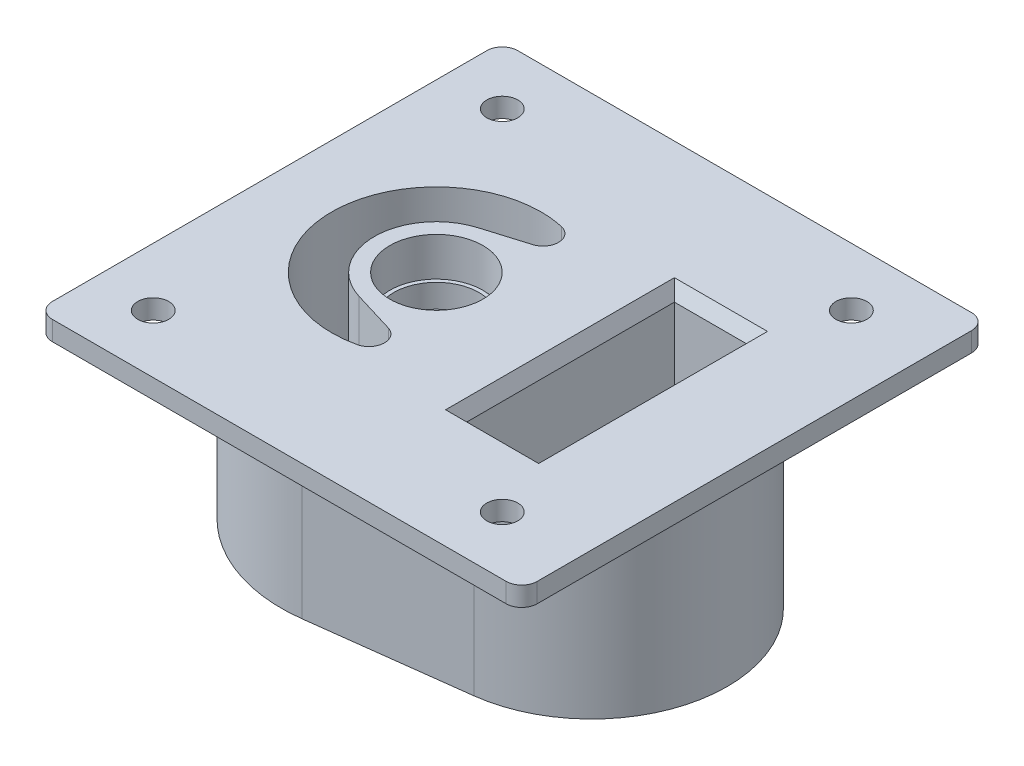
from build123d import *
from OCP.BRepFilletAPI import BRepFilletAPI_MakeChamfer

# Parameters (mm, degrees)
EXTRUDE_1_DEPTH      = 55
SKETCH_2_R           = 4
EXTRUDE_2_DEPTH      = 5
CUT_EXTRUDE_2_DEPTH  = 10
SKETCH_4_R           = 27
CUT_EXTRUDE_1_DEPTH  = 112.126054551
SKETCH_5_R           = 29
CUT_EXTRUDE_3_DEPTH  = 4
SKETCH_8_R           = 7
CUT_EXTRUDE_4_DEPTH  = 112.126054551
SKETCH_7_R           = 2.25
CUT_EXTRUDE_5_DEPTH  = 112.126054551
SKETCH_10_W          = 20
SKETCH_10_H          = 40
CUT_EXTRUDE_6_DEPTH  = 41
SKETCH_11_W          = 20
SKETCH_11_H          = 55
CUT_EXTRUDE_7_DEPTH  = 31.5
SKETCH_12_R          = 3.75
CUT_EXTRUDE_8_DEPTH  = 4.5
CHAMFER_1_SIZE       = 2
CHAMFER_1_SIZE2      = 3.464101615
EXTRUDE_3_DEPTH      = 20
SKETCH_14_R          = 12
CUT_EXTRUDE_9_DEPTH  = 10
SKETCH_15_R          = 11
CUT_EXTRUDE_10_DEPTH = 6
SKETCH_16_R          = 9
CUT_EXTRUDE_11_DEPTH = 109.834737102
FILLET_START         = 36.8876
FILLET_1_DEPTH       = 19.1124
FILLET_START_2       = 30.9999999
FILLET_1_2_OUTLINE_R = 27
FILLET_1_2_DEPTH     = 4.0000001
FILLET_START_3       = 35
FILLET_1_3_DEPTH     = 20
FILLET_1_5_DEPTH     = 4.0000001
CHAMFER_2_SIZE       = 2
CHAMFER_2_SIZE2      = 3.464101615
FILLET_2_R           = 2


with BuildPart() as part:
    # 草图1 → 凸台-拉伸1 (new body)
    with BuildSketch(Plane(origin=(0, 0, 0), x_dir=(1, 0, 0), z_dir=(0, 1, 0))):
        with BuildLine():
            Line((5, 39.686269666), (44.375, 34.725485958))
            ThreePointArc((44.375, 34.725485958), (75, 0), (44.375, -34.725485958))
            Line((44.375, -34.725485958), (5, -39.686269666))
            ThreePointArc((5, -39.686269666), (-40, 0), (5, 39.686269666))
        make_face()
    extrude(amount=EXTRUDE_1_DEPTH)

    # 草图6 → 切除-拉伸2 (cut)
    with BuildSketch(Plane.XZ):
        with BuildLine():
            Line((4.75, -37.701956183), (44.125, -32.741172474))
            ThreePointArc((44.125, -32.741172474), (73, 0), (44.125, 32.741172474))
            Line((44.125, 32.741172474), (4.75, 37.701956183))
            ThreePointArc((4.75, 37.701956183), (-38, 0), (4.75, -37.701956183))
        make_face()
    extrude(amount=-CUT_EXTRUDE_2_DEPTH, mode=Mode.SUBTRACT)

    # 草图4 → 切除-拉伸1 (cut, through all)
    with BuildSketch(Plane.XZ.offset(-10)):
        with Locations(Location((0, 0, 0), (0, 0, 270))):
            Circle(SKETCH_4_R)
    extrude(amount=-CUT_EXTRUDE_1_DEPTH, mode=Mode.SUBTRACT)

    # 草图5 → 切除-拉伸3 (cut)
    with BuildSketch(Plane.XZ.offset(-10)):
        with Locations(Location((0, 0, 0), (0, 0, 270))):
            Circle(SKETCH_5_R)
    extrude(amount=-CUT_EXTRUDE_3_DEPTH, mode=Mode.SUBTRACT)

    # 草图8 → 切除-拉伸4 (cut, through all)
    with BuildSketch(Plane(origin=(0, 10, 0), x_dir=(-1, 0, 0), z_dir=(0, -1, 0))):
        with Locations(Location((-43.874821937, 10, 0), (0, 0, 90))):
            Circle(SKETCH_8_R)
    extrude(amount=-CUT_EXTRUDE_4_DEPTH, mode=Mode.SUBTRACT)

    # 草图7 → 切除-拉伸5 (cut, through all)
    with BuildSketch(Plane.XZ.offset(-10)):
        with Locations(Location((38.874821937, 24.75, 0), (0, 0, 270))):
            Circle(SKETCH_7_R)
        with Locations(Location((48.874821937, 24.75, 0), (0, 0, 270))):
            Circle(SKETCH_7_R)
        with Locations(Location((48.874821937, -24.75, 0), (0, 0, 270))):
            Circle(SKETCH_7_R)
        with Locations(Location((38.874821937, -24.75, 0), (0, 0, 270))):
            Circle(SKETCH_7_R)
    extrude(amount=-CUT_EXTRUDE_5_DEPTH, mode=Mode.SUBTRACT)

    # 草图10 → 切除-拉伸6 (cut)
    with BuildSketch(Plane(origin=(0, 55, 0), x_dir=(1, 0, 0), z_dir=(0, 1, 0))):
        with Locations((43.874821937, -0.15)):
            Rectangle(SKETCH_10_W, SKETCH_10_H)
    extrude(amount=-CUT_EXTRUDE_6_DEPTH, mode=Mode.SUBTRACT)

    # 草图11 → 切除-拉伸7 (cut)
    with BuildSketch(Plane(origin=(0, 55, 0), x_dir=(1, 0, 0), z_dir=(0, 1, 0))):
        with Locations((43.874821937, 0)):
            Rectangle(SKETCH_11_W, SKETCH_11_H)
    extrude(amount=-CUT_EXTRUDE_7_DEPTH, mode=Mode.SUBTRACT)

    # 草图12 → 切除-拉伸8 (cut)
    with BuildSketch(Plane.XZ.offset(-10)):
        with Locations(Location((38.874821937, 24.75, 0), (0, 0, 270))):
            Circle(SKETCH_12_R)
        with Locations(Location((48.874821937, 24.75, 0), (0, 0, 270))):
            Circle(SKETCH_12_R)
        with Locations(Location((48.874821937, -24.75, 0), (0, 0, 270))):
            Circle(SKETCH_12_R)
        with Locations(Location((38.874821937, -24.75, 0), (0, 0, 270))):
            Circle(SKETCH_12_R)
    extrude(amount=-CUT_EXTRUDE_8_DEPTH, mode=Mode.SUBTRACT)

    # 倒角1: one chamfer whose edges measure the first distance from different faces: ONE call of the kernel's chamfer builder (chamfer() names one face for all edges)
    chamfer_1_edges_1 = [part.edges().sort_by_distance(p)[0] for p in [
        (43.874821937, 23.5, -19.85),
    ]]
    chamfer_1_side_1 = [part.faces().sort_by_distance(p)[0] for p in [
        (43.874821937, 23.5, -23.392848958),
    ]]
    chamfer_1_edges_2 = [part.edges().sort_by_distance(p)[0] for p in [
        (43.874821937, 23.5, 20.15),
    ]]
    chamfer_1_side_2 = [part.faces().sort_by_distance(p)[0] for p in [
        (43.874821937, 23.5, 23.569573074),
    ]]
    chamfer_1 = BRepFilletAPI_MakeChamfer(part.part.solid().wrapped)
    for e in chamfer_1_edges_1:
        chamfer_1.Add(CHAMFER_1_SIZE, CHAMFER_1_SIZE2, e.wrapped, chamfer_1_side_1[0].wrapped)  # the first distance lies on this face
    for e in chamfer_1_edges_2:
        chamfer_1.Add(CHAMFER_1_SIZE, CHAMFER_1_SIZE2, e.wrapped, chamfer_1_side_2[0].wrapped)  # the first distance lies on this face
    add(Compound.cast(chamfer_1.Shape()), mode=Mode.REPLACE)


with BuildPart() as body_2:
    # 草图2 → 凸台-拉伸2 (new body)
    # profile 1 of 4: a face of its own
    with BuildSketch(Plane(origin=(0, 55, 0), x_dir=(1, 0, 0), z_dir=(0, 1, 0))):
        with BuildLine():
            Line((-40, 0), (-43, 0))
            Line((-43, 0), (-43, -60))
            Line((-43, -60), (82, -60))
            Line((82, -60), (82, 0))
            Line((82, 0), (75, 0))
            ThreePointArc((75, 0), (66.25, -23.150323972), (44.375, -34.725485958))
            Line((44.375, -34.725485958), (5, -39.686269666))
            ThreePointArc((5, -39.686269666), (-26.457513111, -30), (-40, 0))
        make_face()
        with Locations(Location((-28, -45, 0), (0, 0, 270))):
            Circle(SKETCH_2_R, mode=Mode.SUBTRACT)
        with Locations(Location((62, -45, 0), (0, 0, 270))):
            Circle(SKETCH_2_R, mode=Mode.SUBTRACT)
    # profile 2 of 4: a face of its own
    with BuildSketch(Plane(origin=(0, 55, 0), x_dir=(1, 0, 0), z_dir=(0, 1, 0))):
        with BuildLine():
            Line((82, 60), (-43, 60))
            Line((-43, 60), (-43, 0))
            Line((-43, 0), (-40, 0))
            ThreePointArc((-40, 0), (-26.457513111, 30), (5, 39.686269666))
            Line((5, 39.686269666), (44.375, 34.725485958))
            ThreePointArc((44.375, 34.725485958), (66.25, 23.150323972), (75, 0))
            Line((75, 0), (82, 0))
            Line((82, 0), (82, 60))
        make_face()
        with Locations(Location((-28, 45, 0), (0, 0, 270))):
            Circle(SKETCH_2_R, mode=Mode.SUBTRACT)
        with Locations(Location((62, 45, 0), (0, 0, 270))):
            Circle(SKETCH_2_R, mode=Mode.SUBTRACT)
    # profile 3 of 4: a face of its own
    with BuildSketch(Plane(origin=(0, 55, 0), x_dir=(1, 0, 0), z_dir=(0, 1, 0))):
        with BuildLine():
            Line((-37, 0), (-40, 0))
            ThreePointArc((-40, 0), (-26.457513111, -30), (5, -39.686269666))
            Line((5, -39.686269666), (44.375, -34.725485958))
            ThreePointArc((44.375, -34.725485958), (66.25, -23.150323972), (75, 0))
            Line((75, 0), (72, 0))
            ThreePointArc((72, 0), (64, -21.166010489), (44, -31.749015733))
            Line((44, -31.749015733), (4.625, -36.709799441))
            ThreePointArc((4.625, -36.709799441), (-24.473199627, -27.75), (-37, 0))
        make_face()
    # profile 4 of 4: a face of its own
    with BuildSketch(Plane(origin=(0, 55, 0), x_dir=(1, 0, 0), z_dir=(0, 1, 0))):
        with BuildLine():
            ThreePointArc((5, 39.686269666), (-26.457513111, 30), (-40, 0))
            Line((-40, 0), (-37, 0))
            ThreePointArc((-37, 0), (-24.473199627, 27.75), (4.625, 36.709799441))
            Line((4.625, 36.709799441), (44, 31.749015733))
            ThreePointArc((44, 31.749015733), (64, 21.166010489), (72, 0))
            Line((72, 0), (75, 0))
            ThreePointArc((75, 0), (66.25, 23.150323972), (44.375, 34.725485958))
            Line((44.375, 34.725485958), (5, 39.686269666))
        make_face()
    extrude(amount=-EXTRUDE_2_DEPTH)


    add(part.part)  # 凸台-拉伸3 merges part
    # 草图13 → 凸台-拉伸3 (add)
    with BuildSketch(Plane(origin=(0, 55, 0), x_dir=(-1, 0, 0), z_dir=(0, -1, 0))):
        with BuildLine():
            Line((-27.276363394, 25), (-27.276363394, -25))
            Line((-27.276363394, -25), (4.647124051, -15.310265774))
            ThreePointArc((4.647124051, -15.310265774), (16, 0), (4.647124051, 15.310265774))
            Line((4.647124051, 15.310265774), (-27.276363394, 25))
        make_face()
    extrude(amount=EXTRUDE_3_DEPTH)

    # 草图14 → 切除-拉伸9 (cut)
    with BuildSketch(Plane(origin=(0, 55, 0), x_dir=(-1, 0, 0), z_dir=(0, -1, 0))):
        with Locations(Location((0, 0, 0), (0, 0, 90))):
            Circle(SKETCH_14_R)
    extrude(amount=CUT_EXTRUDE_9_DEPTH, mode=Mode.SUBTRACT)

    # 草图15 → 切除-拉伸10 (cut)
    with BuildSketch(Plane(origin=(0, 45, 0), x_dir=(1, 0, 0), z_dir=(0, 1, 0))):
        with Locations(Location((0, 0, 0), (0, 0, 270))):
            Circle(SKETCH_15_R)
    extrude(amount=-CUT_EXTRUDE_10_DEPTH, mode=Mode.SUBTRACT)

    # 草图16 → 切除-拉伸11 (cut, through all)
    with BuildSketch(Plane(origin=(0, 39, 0), x_dir=(1, 0, 0), z_dir=(0, 1, 0))):
        with Locations(Location((0, 0, 0), (0, 0, 270))):
            Circle(SKETCH_16_R)
    extrude(amount=-CUT_EXTRUDE_11_DEPTH, mode=Mode.SUBTRACT)

    # 圆角1: read off the stored shape, not the designer's step
    # 圆角1 outline → 圆角1 (cut)
    with BuildSketch(Plane(origin=(0, 0, 0), x_dir=(1, 0, 0), z_dir=(0, 1, 0)).offset(FILLET_START)):
        with BuildLine():
            ThreePointArc((-43, 56), (-41.828427125, 58.828427125), (-39, 60))
            Line((-39, 60), (-43, 60))
            Line((-43, 60), (-43, 56))
        make_face()
        with BuildLine():
            Line((82, 60), (78, 60))
            ThreePointArc((78, 60), (80.828427125, 58.828427125), (82, 56))
            Line((82, 56), (82, 60))
        make_face()
        with BuildLine():
            ThreePointArc((-39, -60), (-41.828427125, -58.828427125), (-43, -56))
            Line((-43, -56), (-43, -60))
            Line((-43, -60), (-39, -60))
        make_face()
        with BuildLine():
            Line((82, -60), (82, -56))
            ThreePointArc((82, -56), (80.828427125, -58.828427125), (78, -60))
            Line((78, -60), (82, -60))
        make_face()
    extrude(amount=FILLET_1_DEPTH, mode=Mode.SUBTRACT)

    # Fillet 1 2 outline → Fillet 1 2 (add)
    with BuildSketch(Plane(origin=(0, 0, 0), x_dir=(1, 0, 0), z_dir=(0, 1, 0)).offset(FILLET_START_2)):
        Circle(FILLET_1_2_OUTLINE_R)
    extrude(amount=FILLET_1_2_DEPTH)

    # Fillet 1 3 outline → Fillet 1 3 (add)
    with BuildSketch(Plane(origin=(0, 0, 0), x_dir=(1, 0, 0), z_dir=(0, 1, 0)).offset(FILLET_START_3)):
        with BuildLine():
            ThreePointArc((16.163893596, 21.62703271), (11.299835716, 24.521698816), (5.939171742, 26.33868332))
            ThreePointArc((5.939171742, 26.33868332), (9.056636873, 22.582442052), (6.221075459, 18.609089718))
            Line((6.221075459, 18.609089718), (16.163893596, 21.62703271))
        make_face()
        with BuildLine():
            ThreePointArc((6.221075459, -18.609089718), (9.056636873, -22.582442052), (5.939171742, -26.33868332))
            ThreePointArc((5.939171742, -26.33868332), (11.299835716, -24.521698816), (16.163893596, -21.62703271))
            Line((16.163893596, -21.62703271), (6.221075459, -18.609089718))
        make_face()
    extrude(amount=FILLET_1_3_DEPTH)

    # Fillet 1 4 outline → Fillet 1 4 (revolve, cut)
    with BuildSketch(Plane.XY):
        with BuildLine():
            Line((0, 31), (27, 31))
            ThreePointArc((27, 31), (25.828427125, 33.828427125), (23, 35))
            Line((23, 35), (0, 35))
            Line((0, 35), (0, 31))
        make_face()
    revolve(axis=Axis((0, 0, 0), (0, 1, 0)), mode=Mode.SUBTRACT)

    # Fillet 1 5 outline → Fillet 1 5 (cut)
    with BuildSketch(Plane(origin=(0, 0, 0), x_dir=(1, 0, 0), z_dir=(0, 1, 0)).offset(FILLET_START_2)):
        with BuildLine():
            ThreePointArc((5.939171742, -26.33868332), (8.530408379, -24.424460998), (8.870030077, -21.220805037))
            ThreePointArc((8.870030077, -21.220805037), (-23, 0), (8.870030077, 21.220805037))
            ThreePointArc((8.870030077, 21.220805037), (8.530408379, 24.424460998), (5.939171742, 26.33868332))
            ThreePointArc((5.939171742, 26.33868332), (-27, 0), (5.939171742, -26.33868332))
        make_face()
    extrude(amount=FILLET_1_5_DEPTH, mode=Mode.SUBTRACT)

    # 倒角2
    chamfer_2_edges = [body_2.edges().sort_by_distance(p)[0] for p in [
        (33.874821937, 55, 0),
        (53.874821937, 55, 0),
        (43.874821937, 55, -27.5),
        (43.874821937, 55, 27.5),
    ]]
    chamfer_2_side = [body_2.faces().sort_by_distance(p)[0] for p in [
        (20.277724575, 55, 0),
    ]]
    chamfer(chamfer_2_edges, length=CHAMFER_2_SIZE, length2=CHAMFER_2_SIZE2, reference=chamfer_2_side[0])

    # 圆角2
    fillet_2_edges = [body_2.edges().sort_by_distance(p)[0] for p in [
        (-40, 50, 0),
        (24.6875, 50, 37.205877812),
        (75, 50, 0),
        (24.6875, 50, -37.205877812),
    ]]
    fillet(fillet_2_edges, radius=FILLET_2_R)


solid = body_2.part
